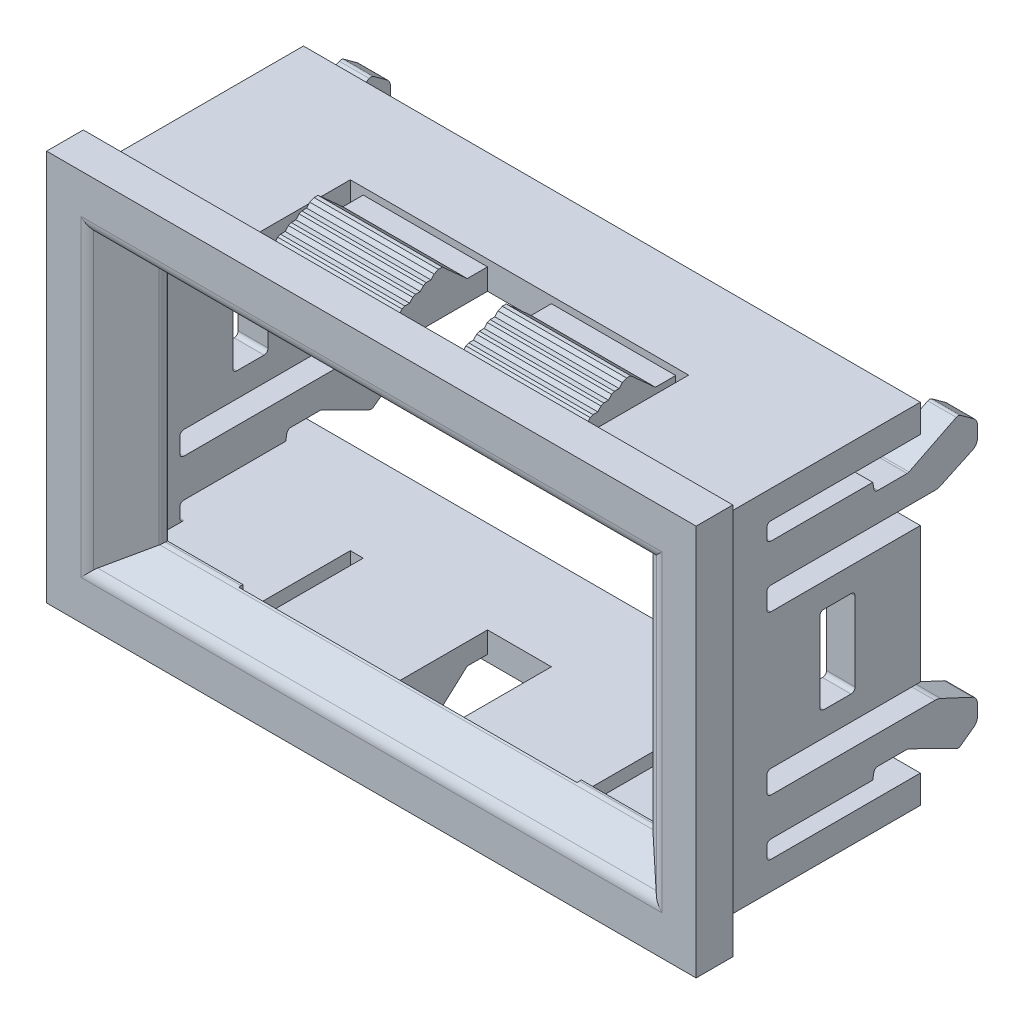
from build123d import *

# Parameters (mm, degrees)
ESQUISSE1_W                         = 47.8
ESQUISSE1_H                         = 28.8
BOSS_EXTRU_1_DEPTH                  = 2.7
ESQUISSE2_W                         = 45.4
ESQUISSE2_H                         = 25.7
BOSS_EXTRU_2_DEPTH                  = 19.2
ESQUISSE3_W                         = 42
ESQUISSE3_H                         = 22
ENL_V_MAT_EXTRU_1_DEPTH             = 3
BOSS_EXTRU_3_REACH                  = 35.87
BOSS_EXTRU_3_DIRECTION_2_REACH      = 35.87
BOSS_EXTRU_4_REACH                  = 35.87
BOSS_EXTRU_4_DIRECTION_2_REACH      = 35.87
CONG_1_R                            = 0.5
CONG_2_R                            = 1
ESQUISSE7_W                         = 41.1
ESQUISSE7_H                         = 21.58
ENL_V_MAT_EXTRU_2_DEPTH             = 18.9
ENL_V_MAT_EXTRU_3_DEPTH             = 34.870488629
ENL_V_MAT_EXTRU_3_DEPTH_BACK        = 34.870488629
ENL_V_MAT_EXTRU_4_DEPTH             = 34.870488629
ENL_V_MAT_EXTRU_4_DEPTH_BACK        = 34.870488629
BOSS_EXTRU_5_DEPTH                  = 9.15
BOSS_EXTRU_6_DEPTH                  = 9.15
ENL_V_MAT_EXTRU_5_REACH             = 35.87
ENL_V_MAT_EXTRU_5_DIRECTION_2_REACH = 35.87


with BuildPart() as part:
    # Esquisse1 → Boss.-Extru.1 (new body)
    with BuildSketch(Plane.XY):
        Rectangle(ESQUISSE1_W, ESQUISSE1_H)
    extrude(amount=BOSS_EXTRU_1_DEPTH)

    # Esquisse2 → Boss.-Extru.2 (add)
    with BuildSketch(Plane(origin=(0, 0, 0), x_dir=(-1, 0, 0), z_dir=(0, 0, -1))):
        Rectangle(ESQUISSE2_W, ESQUISSE2_H)
    extrude(amount=BOSS_EXTRU_2_DEPTH)

    # Esquisse3 → Enlèv. mat.-Extru.1 (cut)
    with BuildSketch(Plane.XY.offset(2.7)):
        Rectangle(ESQUISSE3_W, ESQUISSE3_H)
    extrude(amount=-ENL_V_MAT_EXTRU_1_DEPTH, mode=Mode.SUBTRACT)

    # Esquisse5 → Boss.-Extru.3 (add, up to next)
    with BuildSketch(Plane(origin=(0, 0, 0), x_dir=(0, 0, -1), z_dir=(1, 0, 0)), mode=Mode.PRIVATE) as boss_extru_3_sk1:
        Polygon((-2.7, 11), (0, 9), (0.3, 9), (0.3, 11), align=None)
    boss_extru_3_tool1 = extrude(boss_extru_3_sk1.sketch, amount=BOSS_EXTRU_3_REACH, mode=Mode.PRIVATE) - part.part
    # Esquisse5 → Boss.-Extru.3 (add, up to next)
    with BuildSketch(Plane(origin=(0, 0, 0), x_dir=(0, 0, -1), z_dir=(1, 0, 0)), mode=Mode.PRIVATE) as boss_extru_3_sk2:
        Polygon((0.3, -11), (-2.7, -11), (0, -9), (0.3, -9), align=None)
    boss_extru_3_tool2 = extrude(boss_extru_3_sk2.sketch, amount=BOSS_EXTRU_3_REACH, mode=Mode.PRIVATE) - part.part
    add(boss_extru_3_tool1.solids().sort_by_distance((0, 10.272727, 0.709091))[0])
    add(boss_extru_3_tool2.solids().sort_by_distance((0, -10.272727, 0.709091))[0])

    # Esquisse5 → Boss.-Extru.3 direction 2 (add, up to next)
    with BuildSketch(Plane(origin=(0, 0, 0), x_dir=(0, 0, -1), z_dir=(1, 0, 0)), mode=Mode.PRIVATE) as boss_extru_3_direction_2_sk1:
        Polygon((-2.7, 11), (0, 9), (0.3, 9), (0.3, 11), align=None)
    boss_extru_3_direction_2_tool1 = extrude(boss_extru_3_direction_2_sk1.sketch, amount=-BOSS_EXTRU_3_DIRECTION_2_REACH, mode=Mode.PRIVATE) - part.part
    # Esquisse5 → Boss.-Extru.3 direction 2 (add, up to next)
    with BuildSketch(Plane(origin=(0, 0, 0), x_dir=(0, 0, -1), z_dir=(1, 0, 0)), mode=Mode.PRIVATE) as boss_extru_3_direction_2_sk2:
        Polygon((0.3, -11), (-2.7, -11), (0, -9), (0.3, -9), align=None)
    boss_extru_3_direction_2_tool2 = extrude(boss_extru_3_direction_2_sk2.sketch, amount=-BOSS_EXTRU_3_DIRECTION_2_REACH, mode=Mode.PRIVATE) - part.part
    add(boss_extru_3_direction_2_tool1.solids().sort_by_distance((0, 10.272727, 0.709091))[0])
    add(boss_extru_3_direction_2_tool2.solids().sort_by_distance((0, -10.272727, 0.709091))[0])

    # Esquisse6 → Boss.-Extru.4 (add, up to next)
    with BuildSketch(Plane(origin=(0, 0, 0), x_dir=(1, 0, 0), z_dir=(0, 1, 0)), mode=Mode.PRIVATE) as boss_extru_4_sk1:
        Polygon((-21, -2.7), (-18, 0), (-18, 0.3), (-21, 0.3), align=None)
    boss_extru_4_tool1 = extrude(boss_extru_4_sk1.sketch, amount=BOSS_EXTRU_4_REACH, mode=Mode.PRIVATE) - part.part
    # Esquisse6 → Boss.-Extru.4 (add, up to next)
    with BuildSketch(Plane(origin=(0, 0, 0), x_dir=(1, 0, 0), z_dir=(0, 1, 0)), mode=Mode.PRIVATE) as boss_extru_4_sk2:
        Polygon((18, 0), (18, 0.3), (21, 0.3), (21, -2.7), align=None)
    boss_extru_4_tool2 = extrude(boss_extru_4_sk2.sketch, amount=BOSS_EXTRU_4_REACH, mode=Mode.PRIVATE) - part.part
    add(boss_extru_4_tool1.solids().sort_by_distance((-19.909091, 0, 0.709091))[0])
    add(boss_extru_4_tool2.solids().sort_by_distance((19.909091, 0, 0.709091))[0])

    # Esquisse6 → Boss.-Extru.4 direction 2 (add, up to next)
    with BuildSketch(Plane(origin=(0, 0, 0), x_dir=(1, 0, 0), z_dir=(0, 1, 0)), mode=Mode.PRIVATE) as boss_extru_4_direction_2_sk1:
        Polygon((-21, -2.7), (-18, 0), (-18, 0.3), (-21, 0.3), align=None)
    boss_extru_4_direction_2_tool1 = extrude(boss_extru_4_direction_2_sk1.sketch, amount=-BOSS_EXTRU_4_DIRECTION_2_REACH, mode=Mode.PRIVATE) - part.part
    # Esquisse6 → Boss.-Extru.4 direction 2 (add, up to next)
    with BuildSketch(Plane(origin=(0, 0, 0), x_dir=(1, 0, 0), z_dir=(0, 1, 0)), mode=Mode.PRIVATE) as boss_extru_4_direction_2_sk2:
        Polygon((18, 0), (18, 0.3), (21, 0.3), (21, -2.7), align=None)
    boss_extru_4_direction_2_tool2 = extrude(boss_extru_4_direction_2_sk2.sketch, amount=-BOSS_EXTRU_4_DIRECTION_2_REACH, mode=Mode.PRIVATE) - part.part
    add(boss_extru_4_direction_2_tool1.solids().sort_by_distance((-19.909091, 0, 0.709091))[0])
    add(boss_extru_4_direction_2_tool2.solids().sort_by_distance((19.909091, 0, 0.709091))[0])

    # Congé1
    # the kernel refuses this fillet: 0.5 mm, written as the material it takes off along each edge
    with BuildSketch(Plane(origin=(18, -9, 0), x_dir=(0, -0.5952275506257343, 0.8035571933447481), z_dir=(-1, 0, 0))) as cong_1_piece_1_section:
        with BuildLine():
            CenterArc((CONG_1_R * 0.330029761641, -CONG_1_R), CONG_1_R, 90, 36.528855367)
            Line((-CONG_1_R * 0.265197788985, -CONG_1_R * 0.196442806655), (0, 0))
            Line((0, 0), (CONG_1_R * 0.330029761641, 0))
        make_face()
    cong_1_piece_1 = extrude(amount=36, mode=Mode.PRIVATE)
    cong_1_piece_1 = split(cong_1_piece_1, bisect_by=Plane(origin=(17.922718126, -8.998318551, -0.069553686), z_dir=(0.6689647316224508, 0, -0.7432941462471654)), keep=Keep.TOP, mode=Mode.PRIVATE)
    add(cong_1_piece_1, mode=Mode.SUBTRACT)
    with BuildSketch(Plane(origin=(18.412537202, -9, 0), x_dir=(0, -0.5952275506257328, 0.8035571933447492), z_dir=(-1, 0, 0))) as cong_1_piece_2_section:
        with BuildLine():
            CenterArc((CONG_1_R * 0.330029761641, -CONG_1_R), CONG_1_R, 90, 36.528855367)
            Line((-CONG_1_R * 0.265197788985, -CONG_1_R * 0.196442806655), (0, 0))
            Line((0, 0), (CONG_1_R * 0.330029761641, 0))
        make_face()
    cong_1_piece_2 = extrude(amount=36.412537202, mode=Mode.PRIVATE)
    cong_1_piece_2 = split(cong_1_piece_2, bisect_by=Plane(origin=(18.064588284, -9.056528248, 0.058129455), z_dir=(-0.6689647316224508, 0, 0.7432941462471654)), keep=Keep.TOP, mode=Mode.PRIVATE)
    cong_1_piece_2 = split(cong_1_piece_2, bisect_by=Plane(origin=(18, -9.056528248, 0.080316271), z_dir=(1, 0, 0)), keep=Keep.TOP, mode=Mode.PRIVATE)
    add(cong_1_piece_2, mode=Mode.SUBTRACT)
    with BuildSketch(Plane(origin=(18, -9, 0), x_dir=(0, -0.5952275506257343, 0.8035571933447481), z_dir=(-1, 0, 0))) as cong_1_piece_3_section:
        with BuildLine():
            CenterArc((CONG_1_R * 0.330029761641, -CONG_1_R), CONG_1_R, 90, 36.528855367)
            Line((-CONG_1_R * 0.265197788985, -CONG_1_R * 0.196442806655), (0, 0))
            Line((0, 0), (CONG_1_R * 0.330029761641, 0))
        make_face()
    cong_1_piece_3 = extrude(amount=36, mode=Mode.PRIVATE)
    cong_1_piece_3 = split(cong_1_piece_3, bisect_by=Plane(origin=(-8.052075254, -9.019922949, -8.953132271), z_dir=(0.6689647316224502, 0, 0.7432941462471659)), keep=Keep.TOP, mode=Mode.PRIVATE)
    cong_1_piece_3 = split(cong_1_piece_3, bisect_by=Plane(origin=(8.052075254, -9.019922949, -8.953132271), z_dir=(-0.6689647316224508, 0, 0.7432941462471654)), keep=Keep.TOP, mode=Mode.PRIVATE)
    add(cong_1_piece_3, mode=Mode.SUBTRACT)
    with BuildSketch(Plane(origin=(18, -9, 0), x_dir=(0, -0.5952275506257343, 0.8035571933447481), z_dir=(-1, 0, 0))) as cong_1_piece_4_section:
        with BuildLine():
            CenterArc((CONG_1_R * 0.330029761641, -CONG_1_R), CONG_1_R, 90, 36.528855367)
            Line((-CONG_1_R * 0.265197788985, -CONG_1_R * 0.196442806655), (0, 0))
            Line((0, 0), (CONG_1_R * 0.330029761641, 0))
        make_face()
    cong_1_piece_4 = extrude(amount=36, mode=Mode.PRIVATE)
    cong_1_piece_4 = split(cong_1_piece_4, bisect_by=Plane(origin=(-17.922718126, -8.998318551, -0.069553686), z_dir=(-0.6689647316224502, 0, -0.7432941462471659)), keep=Keep.TOP, mode=Mode.PRIVATE)
    add(cong_1_piece_4, mode=Mode.SUBTRACT)
    with BuildSketch(Plane(origin=(18, -9, 0), x_dir=(0, -0.5952275506257343, 0.8035571933447481), z_dir=(-1, 0, 0))) as cong_1_piece_5_section:
        with BuildLine():
            CenterArc((CONG_1_R * 0.330029761641, -CONG_1_R), CONG_1_R, 90, 36.528855367)
            Line((-CONG_1_R * 0.265197788985, -CONG_1_R * 0.196442806655), (0, 0))
            Line((0, 0), (CONG_1_R * 0.330029761641, 0))
        make_face()
    cong_1_piece_5 = extrude(amount=36.412537202, mode=Mode.PRIVATE)
    cong_1_piece_5 = split(cong_1_piece_5, bisect_by=Plane(origin=(-18.064588284, -9.056528248, 0.058129455), z_dir=(0.6689647316224502, 0, 0.7432941462471659)), keep=Keep.TOP, mode=Mode.PRIVATE)
    cong_1_piece_5 = split(cong_1_piece_5, bisect_by=Plane(origin=(-18, -9.056528248, 0.080316271), z_dir=(-1, 0, 0)), keep=Keep.TOP, mode=Mode.PRIVATE)
    add(cong_1_piece_5, mode=Mode.SUBTRACT)
    with BuildSketch(Plane(origin=(-18.412537202, 9, 0), x_dir=(0, 0, -1), z_dir=(1, 0, 0))) as cong_1_piece_6_section:
        with BuildLine():
            CenterArc((CONG_1_R * 0.330029761641, CONG_1_R), CONG_1_R, 233.471144633, 36.528855367)
            Line((-CONG_1_R * 0.265197788985, CONG_1_R * 0.196442806655), (0, 0))
            Line((0, 0), (CONG_1_R * 0.330029761641, 0))
        make_face()
    cong_1_piece_6 = extrude(amount=36.412537202, mode=Mode.PRIVATE)
    cong_1_piece_6 = split(cong_1_piece_6, bisect_by=Plane(origin=(-18, 9.056528248, 0.080316272), z_dir=(-1, 0, 0)), keep=Keep.TOP, mode=Mode.PRIVATE)
    cong_1_piece_6 = split(cong_1_piece_6, bisect_by=Plane(origin=(-18.064588286, 9.056528248, 0.058129457), z_dir=(0.6689647316224502, 0, 0.7432941462471659)), keep=Keep.TOP, mode=Mode.PRIVATE)
    add(cong_1_piece_6, mode=Mode.SUBTRACT)
    with BuildSketch(Plane(origin=(-18, 9, 0), x_dir=(0, 0, -1), z_dir=(1, 0, 0))) as cong_1_piece_7_section:
        with BuildLine():
            CenterArc((CONG_1_R * 0.330029761641, CONG_1_R), CONG_1_R, 233.471144633, 36.528855367)
            Line((-CONG_1_R * 0.265197788985, CONG_1_R * 0.196442806655), (0, 0))
            Line((0, 0), (CONG_1_R * 0.330029761641, 0))
        make_face()
    cong_1_piece_7 = extrude(amount=36, mode=Mode.PRIVATE)
    cong_1_piece_7 = split(cong_1_piece_7, bisect_by=Plane(origin=(-17.922718127, 8.998318551, -0.069553686), z_dir=(-0.6689647316224502, 0, -0.7432941462471659)), keep=Keep.TOP, mode=Mode.PRIVATE)
    add(cong_1_piece_7, mode=Mode.SUBTRACT)
    with BuildSketch(Plane(origin=(-18, 9, 0), x_dir=(0, 0, -1), z_dir=(1, 0, 0))) as cong_1_piece_8_section:
        with BuildLine():
            CenterArc((CONG_1_R * 0.330029761641, CONG_1_R), CONG_1_R, 233.471144633, 36.528855367)
            Line((-CONG_1_R * 0.265197788985, CONG_1_R * 0.196442806655), (0, 0))
            Line((0, 0), (CONG_1_R * 0.330029761641, 0))
        make_face()
    cong_1_piece_8 = extrude(amount=36, mode=Mode.PRIVATE)
    cong_1_piece_8 = split(cong_1_piece_8, bisect_by=Plane(origin=(-8.052075254, 9.019922949, -8.953132271), z_dir=(0.6689647316224502, 0, 0.7432941462471659)), keep=Keep.TOP, mode=Mode.PRIVATE)
    cong_1_piece_8 = split(cong_1_piece_8, bisect_by=Plane(origin=(8.052075254, 9.019922949, -8.953132271), z_dir=(-0.6689647316224508, 0, 0.7432941462471654)), keep=Keep.TOP, mode=Mode.PRIVATE)
    add(cong_1_piece_8, mode=Mode.SUBTRACT)
    with BuildSketch(Plane(origin=(-18, 9, 0), x_dir=(0, 0, -1), z_dir=(1, 0, 0))) as cong_1_piece_9_section:
        with BuildLine():
            CenterArc((CONG_1_R * 0.330029761641, CONG_1_R), CONG_1_R, 233.471144633, 36.528855367)
            Line((-CONG_1_R * 0.265197788985, CONG_1_R * 0.196442806655), (0, 0))
            Line((0, 0), (CONG_1_R * 0.330029761641, 0))
        make_face()
    cong_1_piece_9 = extrude(amount=36.412537202, mode=Mode.PRIVATE)
    cong_1_piece_9 = split(cong_1_piece_9, bisect_by=Plane(origin=(18, 9.056528248, 0.080316272), z_dir=(1, 0, 0)), keep=Keep.TOP, mode=Mode.PRIVATE)
    cong_1_piece_9 = split(cong_1_piece_9, bisect_by=Plane(origin=(18.064588286, 9.056528248, 0.058129457), z_dir=(-0.6689647316224508, 0, 0.7432941462471654)), keep=Keep.TOP, mode=Mode.PRIVATE)
    add(cong_1_piece_9, mode=Mode.SUBTRACT)
    with BuildSketch(Plane(origin=(-18, 9, 0), x_dir=(0, 0, -1), z_dir=(1, 0, 0))) as cong_1_piece_10_section:
        with BuildLine():
            CenterArc((CONG_1_R * 0.330029761641, CONG_1_R), CONG_1_R, 233.471144633, 36.528855367)
            Line((-CONG_1_R * 0.265197788985, CONG_1_R * 0.196442806655), (0, 0))
            Line((0, 0), (CONG_1_R * 0.330029761641, 0))
        make_face()
    cong_1_piece_10 = extrude(amount=36, mode=Mode.PRIVATE)
    cong_1_piece_10 = split(cong_1_piece_10, bisect_by=Plane(origin=(17.922718127, 8.998318551, -0.069553686), z_dir=(0.6689647316224508, 0, -0.7432941462471654)), keep=Keep.TOP, mode=Mode.PRIVATE)
    add(cong_1_piece_10, mode=Mode.SUBTRACT)
    with BuildSketch(Plane(origin=(-18, -9.556703006, 0), x_dir=(0, 0, -1), z_dir=(0, 1, 0))) as cong_1_piece_11_section:
        with BuildLine():
            CenterArc((CONG_1_R * 0.445362404707, CONG_1_R), CONG_1_R, 221.987212496, 48.012787504)
            Line((-CONG_1_R * 0.29793174154, CONG_1_R * 0.331035268378), (0, 0))
            Line((0, 0), (CONG_1_R * 0.445362404707, 0))
        make_face()
    cong_1_piece_11 = extrude(amount=18.556703006, mode=Mode.PRIVATE)
    cong_1_piece_11 = split(cong_1_piece_11, bisect_by=Plane(origin=(-18.095474591, -9.052623431, 0.071041632), z_dir=(0, 0.8035571933447458, 0.5952275506257375)), keep=Keep.TOP, mode=Mode.PRIVATE)
    cong_1_piece_11 = split(cong_1_piece_11, bisect_by=Plane(origin=(-18.095474591, -9, 0.086335846), z_dir=(0, -1, 0)), keep=Keep.TOP, mode=Mode.PRIVATE)
    add(cong_1_piece_11, mode=Mode.SUBTRACT)
    with BuildSketch(Plane(origin=(-18, -9, 0), x_dir=(0, 0, -1), z_dir=(0, 1, 0))) as cong_1_piece_12_section:
        with BuildLine():
            CenterArc((CONG_1_R * 0.445362404707, CONG_1_R), CONG_1_R, 221.987212496, 48.012787504)
            Line((-CONG_1_R * 0.29793174154, CONG_1_R * 0.331035268378), (0, 0))
            Line((0, 0), (CONG_1_R * 0.445362404707, 0))
        make_face()
    cong_1_piece_12 = extrude(amount=18, mode=Mode.PRIVATE)
    cong_1_piece_12 = split(cong_1_piece_12, bisect_by=Plane(origin=(-18.00198983, -8.926228629, -0.099591351), z_dir=(0, -0.8035571933447458, -0.5952275506257375)), keep=Keep.TOP, mode=Mode.PRIVATE)
    add(cong_1_piece_12, mode=Mode.SUBTRACT)
    with BuildSketch(Plane(origin=(-18, -9, 0), x_dir=(0, 0, -1), z_dir=(0, 1, 0))) as cong_1_piece_13_section:
        with BuildLine():
            CenterArc((CONG_1_R * 0.445362404707, CONG_1_R), CONG_1_R, 221.987212496, 48.012787504)
            Line((-CONG_1_R * 0.29793174154, CONG_1_R * 0.331035268378), (0, 0))
            Line((0, 0), (CONG_1_R * 0.445362404707, 0))
        make_face()
    cong_1_piece_13 = extrude(amount=18, mode=Mode.PRIVATE)
    cong_1_piece_13 = split(cong_1_piece_13, bisect_by=Plane(origin=(-18.035315621, -5.80401026, -4.314586149), z_dir=(0, 0.8035571933447458, 0.5952275506257375)), keep=Keep.TOP, mode=Mode.PRIVATE)
    cong_1_piece_13 = split(cong_1_piece_13, bisect_by=Plane(origin=(-18.035315621, 5.80401026, -4.314586149), z_dir=(0, -0.8035571933447458, 0.5952275506257375)), keep=Keep.TOP, mode=Mode.PRIVATE)
    add(cong_1_piece_13, mode=Mode.SUBTRACT)
    with BuildSketch(Plane(origin=(-18, -9, 0), x_dir=(0, 0, -1), z_dir=(0, 1, 0))) as cong_1_piece_14_section:
        with BuildLine():
            CenterArc((CONG_1_R * 0.445362404707, CONG_1_R), CONG_1_R, 221.987212496, 48.012787504)
            Line((-CONG_1_R * 0.29793174154, CONG_1_R * 0.331035268378), (0, 0))
            Line((0, 0), (CONG_1_R * 0.445362404707, 0))
        make_face()
    cong_1_piece_14 = extrude(amount=18.556703006, mode=Mode.PRIVATE)
    cong_1_piece_14 = split(cong_1_piece_14, bisect_by=Plane(origin=(-18.095474591, 9, 0.086335846), z_dir=(0, 1, 0)), keep=Keep.TOP, mode=Mode.PRIVATE)
    cong_1_piece_14 = split(cong_1_piece_14, bisect_by=Plane(origin=(-18.095474591, 9.052623431, 0.071041632), z_dir=(0, -0.8035571933447458, 0.5952275506257375)), keep=Keep.TOP, mode=Mode.PRIVATE)
    add(cong_1_piece_14, mode=Mode.SUBTRACT)
    with BuildSketch(Plane(origin=(-18, -9, 0), x_dir=(0, 0, -1), z_dir=(0, 1, 0))) as cong_1_piece_15_section:
        with BuildLine():
            CenterArc((CONG_1_R * 0.445362404707, CONG_1_R), CONG_1_R, 221.987212496, 48.012787504)
            Line((-CONG_1_R * 0.29793174154, CONG_1_R * 0.331035268378), (0, 0))
            Line((0, 0), (CONG_1_R * 0.445362404707, 0))
        make_face()
    cong_1_piece_15 = extrude(amount=18, mode=Mode.PRIVATE)
    cong_1_piece_15 = split(cong_1_piece_15, bisect_by=Plane(origin=(-18.00198983, 8.926228629, -0.099591351), z_dir=(0, 0.8035571933447458, -0.5952275506257375)), keep=Keep.TOP, mode=Mode.PRIVATE)
    add(cong_1_piece_15, mode=Mode.SUBTRACT)
    with BuildSketch(Plane(origin=(18, 9.556703006, 0), x_dir=(0, 0, -1), z_dir=(0, -1, 0))) as cong_1_piece_16_section:
        with BuildLine():
            CenterArc((CONG_1_R * 0.445362404707, CONG_1_R), CONG_1_R, 221.987212496, 48.012787504)
            Line((-CONG_1_R * 0.29793174154, CONG_1_R * 0.331035268378), (0, 0))
            Line((0, 0), (CONG_1_R * 0.445362404707, 0))
        make_face()
    cong_1_piece_16 = extrude(amount=18.556703006, mode=Mode.PRIVATE)
    cong_1_piece_16 = split(cong_1_piece_16, bisect_by=Plane(origin=(18.095474591, 9, 0.086335846), z_dir=(0, 1, 0)), keep=Keep.TOP, mode=Mode.PRIVATE)
    cong_1_piece_16 = split(cong_1_piece_16, bisect_by=Plane(origin=(18.095474591, 9.052623431, 0.071041632), z_dir=(0, -0.8035571933447458, 0.5952275506257375)), keep=Keep.TOP, mode=Mode.PRIVATE)
    add(cong_1_piece_16, mode=Mode.SUBTRACT)
    with BuildSketch(Plane(origin=(18, 9, 0), x_dir=(0, 0, -1), z_dir=(0, -1, 0))) as cong_1_piece_17_section:
        with BuildLine():
            CenterArc((CONG_1_R * 0.445362404707, CONG_1_R), CONG_1_R, 221.987212496, 48.012787504)
            Line((-CONG_1_R * 0.29793174154, CONG_1_R * 0.331035268378), (0, 0))
            Line((0, 0), (CONG_1_R * 0.445362404707, 0))
        make_face()
    cong_1_piece_17 = extrude(amount=18, mode=Mode.PRIVATE)
    cong_1_piece_17 = split(cong_1_piece_17, bisect_by=Plane(origin=(18.00198983, 8.926228629, -0.099591351), z_dir=(0, 0.8035571933447458, -0.5952275506257375)), keep=Keep.TOP, mode=Mode.PRIVATE)
    add(cong_1_piece_17, mode=Mode.SUBTRACT)
    with BuildSketch(Plane(origin=(18, 9, 0), x_dir=(0, 0, -1), z_dir=(0, -1, 0))) as cong_1_piece_18_section:
        with BuildLine():
            CenterArc((CONG_1_R * 0.445362404707, CONG_1_R), CONG_1_R, 221.987212496, 48.012787504)
            Line((-CONG_1_R * 0.29793174154, CONG_1_R * 0.331035268378), (0, 0))
            Line((0, 0), (CONG_1_R * 0.445362404707, 0))
        make_face()
    cong_1_piece_18 = extrude(amount=18, mode=Mode.PRIVATE)
    cong_1_piece_18 = split(cong_1_piece_18, bisect_by=Plane(origin=(18.035315621, -5.80401026, -4.314586149), z_dir=(0, 0.8035571933447458, 0.5952275506257375)), keep=Keep.TOP, mode=Mode.PRIVATE)
    cong_1_piece_18 = split(cong_1_piece_18, bisect_by=Plane(origin=(18.035315621, 5.80401026, -4.314586149), z_dir=(0, -0.8035571933447458, 0.5952275506257375)), keep=Keep.TOP, mode=Mode.PRIVATE)
    add(cong_1_piece_18, mode=Mode.SUBTRACT)
    with BuildSketch(Plane(origin=(18, 9, 0), x_dir=(0, 0, -1), z_dir=(0, -1, 0))) as cong_1_piece_19_section:
        with BuildLine():
            CenterArc((CONG_1_R * 0.445362404707, CONG_1_R), CONG_1_R, 221.987212496, 48.012787504)
            Line((-CONG_1_R * 0.29793174154, CONG_1_R * 0.331035268378), (0, 0))
            Line((0, 0), (CONG_1_R * 0.445362404707, 0))
        make_face()
    cong_1_piece_19 = extrude(amount=18.556703006, mode=Mode.PRIVATE)
    cong_1_piece_19 = split(cong_1_piece_19, bisect_by=Plane(origin=(18.095474591, -9.052623431, 0.071041632), z_dir=(0, 0.8035571933447458, 0.5952275506257375)), keep=Keep.TOP, mode=Mode.PRIVATE)
    cong_1_piece_19 = split(cong_1_piece_19, bisect_by=Plane(origin=(18.095474591, -9, 0.086335846), z_dir=(0, -1, 0)), keep=Keep.TOP, mode=Mode.PRIVATE)
    add(cong_1_piece_19, mode=Mode.SUBTRACT)
    with BuildSketch(Plane(origin=(18, 9, 0), x_dir=(0, 0, -1), z_dir=(0, -1, 0))) as cong_1_piece_20_section:
        with BuildLine():
            CenterArc((CONG_1_R * 0.445362404707, CONG_1_R), CONG_1_R, 221.987212496, 48.012787504)
            Line((-CONG_1_R * 0.29793174154, CONG_1_R * 0.331035268378), (0, 0))
            Line((0, 0), (CONG_1_R * 0.445362404707, 0))
        make_face()
    cong_1_piece_20 = extrude(amount=18, mode=Mode.PRIVATE)
    cong_1_piece_20 = split(cong_1_piece_20, bisect_by=Plane(origin=(18.00198983, -8.926228629, -0.099591351), z_dir=(0, -0.8035571933447458, -0.5952275506257375)), keep=Keep.TOP, mode=Mode.PRIVATE)
    add(cong_1_piece_20, mode=Mode.SUBTRACT)
    with BuildSketch(Plane(origin=(18.412537202, -9, 0), x_dir=(0, -0.5952275506257328, 0.8035571933447492), z_dir=(-1, 0, 0))) as cong_1_piece_21a_section:
        with BuildLine():
            CenterArc((CONG_1_R * 0.330029761641, -CONG_1_R), CONG_1_R, 90, 36.528855367)
            Line((-CONG_1_R * 0.265197788985, -CONG_1_R * 0.196442806655), (0, 0))
            Line((0, 0), (CONG_1_R * 0.330029761641, 0))
        make_face()
    cong_1_piece_21a = extrude(amount=36.412537202, mode=Mode.PRIVATE)
    cong_1_piece_21a = split(cong_1_piece_21a, bisect_by=Plane(origin=(18.114134712, -9.017148505, 0.10272124), z_dir=(0.6689647316224508, 0, -0.7432941462471654)), keep=Keep.TOP, mode=Mode.PRIVATE)
    cong_1_piece_21a = split(cong_1_piece_21a, bisect_by=Plane(origin=(18, -9.017148505, -0.013035779), z_dir=(1, 0, 0)), keep=Keep.TOP, mode=Mode.PRIVATE)
    with BuildSketch(Plane(origin=(18, 9, 0), x_dir=(0, 0, -1), z_dir=(0, -1, 0))) as cong_1_piece_21b_section:
        with BuildLine():
            CenterArc((CONG_1_R * 0.445362404707, CONG_1_R), CONG_1_R, 221.987212496, 48.012787504)
            Line((-CONG_1_R * 0.29793174154, CONG_1_R * 0.331035268378), (0, 0))
            Line((0, 0), (CONG_1_R * 0.445362404707, 0))
        make_face()
    cong_1_piece_21b = extrude(amount=18.556703006, mode=Mode.PRIVATE)
    cong_1_piece_21b = split(cong_1_piece_21b, bisect_by=Plane(origin=(18.033082392, -9.092474243, 0.124840228), z_dir=(0, -0.8035571933447458, -0.5952275506257375)), keep=Keep.TOP, mode=Mode.PRIVATE)
    cong_1_piece_21b = split(cong_1_piece_21b, bisect_by=Plane(origin=(18.033082392, -9, -0.019266418), z_dir=(0, -1, 0)), keep=Keep.TOP, mode=Mode.PRIVATE)
    cong_1_piece_21 = cong_1_piece_21a & cong_1_piece_21b
    add(cong_1_piece_21, mode=Mode.SUBTRACT)
    with BuildSketch(Plane(origin=(18, -9, 0), x_dir=(0, -0.5952275506257343, 0.8035571933447481), z_dir=(-1, 0, 0))) as cong_1_piece_22a_section:
        with BuildLine():
            CenterArc((CONG_1_R * 0.330029761641, -CONG_1_R), CONG_1_R, 90, 36.528855367)
            Line((-CONG_1_R * 0.265197788985, -CONG_1_R * 0.196442806655), (0, 0))
            Line((0, 0), (CONG_1_R * 0.330029761641, 0))
        make_face()
    cong_1_piece_22a = extrude(amount=36.412537202, mode=Mode.PRIVATE)
    cong_1_piece_22a = split(cong_1_piece_22a, bisect_by=Plane(origin=(-18.114134712, -9.017148505, 0.10272124), z_dir=(-0.6689647316224502, 0, -0.7432941462471659)), keep=Keep.TOP, mode=Mode.PRIVATE)
    cong_1_piece_22a = split(cong_1_piece_22a, bisect_by=Plane(origin=(-18, -9.017148505, -0.013035779), z_dir=(-1, 0, 0)), keep=Keep.TOP, mode=Mode.PRIVATE)
    with BuildSketch(Plane(origin=(-18, -9.556703006, 0), x_dir=(0, 0, -1), z_dir=(0, 1, 0))) as cong_1_piece_22b_section:
        with BuildLine():
            CenterArc((CONG_1_R * 0.445362404707, CONG_1_R), CONG_1_R, 221.987212496, 48.012787504)
            Line((-CONG_1_R * 0.29793174154, CONG_1_R * 0.331035268378), (0, 0))
            Line((0, 0), (CONG_1_R * 0.445362404707, 0))
        make_face()
    cong_1_piece_22b = extrude(amount=18.556703006, mode=Mode.PRIVATE)
    cong_1_piece_22b = split(cong_1_piece_22b, bisect_by=Plane(origin=(-18.033082392, -9.092474243, 0.124840228), z_dir=(0, -0.8035571933447458, -0.5952275506257375)), keep=Keep.TOP, mode=Mode.PRIVATE)
    cong_1_piece_22b = split(cong_1_piece_22b, bisect_by=Plane(origin=(-18.033082392, -9, -0.019266418), z_dir=(0, -1, 0)), keep=Keep.TOP, mode=Mode.PRIVATE)
    cong_1_piece_22 = cong_1_piece_22a & cong_1_piece_22b
    add(cong_1_piece_22, mode=Mode.SUBTRACT)
    with BuildSketch(Plane(origin=(-18.412537202, 9, 0), x_dir=(0, 0, -1), z_dir=(1, 0, 0))) as cong_1_piece_23a_section:
        with BuildLine():
            CenterArc((CONG_1_R * 0.330029761641, CONG_1_R), CONG_1_R, 233.471144633, 36.528855367)
            Line((-CONG_1_R * 0.265197788985, CONG_1_R * 0.196442806655), (0, 0))
            Line((0, 0), (CONG_1_R * 0.330029761641, 0))
        make_face()
    cong_1_piece_23a = extrude(amount=36.412537202, mode=Mode.PRIVATE)
    cong_1_piece_23a = split(cong_1_piece_23a, bisect_by=Plane(origin=(-18, 9.017148504, -0.013035779), z_dir=(-1, 0, 0)), keep=Keep.TOP, mode=Mode.PRIVATE)
    cong_1_piece_23a = split(cong_1_piece_23a, bisect_by=Plane(origin=(-18.114134713, 9.017148504, 0.102721242), z_dir=(-0.6689647316224502, 0, -0.7432941462471659)), keep=Keep.TOP, mode=Mode.PRIVATE)
    with BuildSketch(Plane(origin=(-18, -9, 0), x_dir=(0, 0, -1), z_dir=(0, 1, 0))) as cong_1_piece_23b_section:
        with BuildLine():
            CenterArc((CONG_1_R * 0.445362404707, CONG_1_R), CONG_1_R, 221.987212496, 48.012787504)
            Line((-CONG_1_R * 0.29793174154, CONG_1_R * 0.331035268378), (0, 0))
            Line((0, 0), (CONG_1_R * 0.445362404707, 0))
        make_face()
    cong_1_piece_23b = extrude(amount=18.556703006, mode=Mode.PRIVATE)
    cong_1_piece_23b = split(cong_1_piece_23b, bisect_by=Plane(origin=(-18.033082392, 9, -0.019266418), z_dir=(0, 1, 0)), keep=Keep.TOP, mode=Mode.PRIVATE)
    cong_1_piece_23b = split(cong_1_piece_23b, bisect_by=Plane(origin=(-18.033082392, 9.092474243, 0.124840228), z_dir=(0, 0.8035571933447458, -0.5952275506257375)), keep=Keep.TOP, mode=Mode.PRIVATE)
    cong_1_piece_23 = cong_1_piece_23a & cong_1_piece_23b
    add(cong_1_piece_23, mode=Mode.SUBTRACT)
    with BuildSketch(Plane(origin=(18, 9.556703006, 0), x_dir=(0, 0, -1), z_dir=(0, -1, 0))) as cong_1_piece_24a_section:
        with BuildLine():
            CenterArc((CONG_1_R * 0.445362404707, CONG_1_R), CONG_1_R, 221.987212496, 48.012787504)
            Line((-CONG_1_R * 0.29793174154, CONG_1_R * 0.331035268378), (0, 0))
            Line((0, 0), (CONG_1_R * 0.445362404707, 0))
        make_face()
    cong_1_piece_24a = extrude(amount=18.556703006, mode=Mode.PRIVATE)
    cong_1_piece_24a = split(cong_1_piece_24a, bisect_by=Plane(origin=(18.033082392, 9, -0.019266418), z_dir=(0, 1, 0)), keep=Keep.TOP, mode=Mode.PRIVATE)
    cong_1_piece_24a = split(cong_1_piece_24a, bisect_by=Plane(origin=(18.033082392, 9.092474243, 0.124840228), z_dir=(0, 0.8035571933447458, -0.5952275506257375)), keep=Keep.TOP, mode=Mode.PRIVATE)
    with BuildSketch(Plane(origin=(-18, 9, 0), x_dir=(0, 0, -1), z_dir=(1, 0, 0))) as cong_1_piece_24b_section:
        with BuildLine():
            CenterArc((CONG_1_R * 0.330029761641, CONG_1_R), CONG_1_R, 233.471144633, 36.528855367)
            Line((-CONG_1_R * 0.265197788985, CONG_1_R * 0.196442806655), (0, 0))
            Line((0, 0), (CONG_1_R * 0.330029761641, 0))
        make_face()
    cong_1_piece_24b = extrude(amount=36.412537202, mode=Mode.PRIVATE)
    cong_1_piece_24b = split(cong_1_piece_24b, bisect_by=Plane(origin=(18, 9.017148504, -0.013035779), z_dir=(1, 0, 0)), keep=Keep.TOP, mode=Mode.PRIVATE)
    cong_1_piece_24b = split(cong_1_piece_24b, bisect_by=Plane(origin=(18.114134713, 9.017148504, 0.102721242), z_dir=(0.6689647316224508, 0, -0.7432941462471654)), keep=Keep.TOP, mode=Mode.PRIVATE)
    cong_1_piece_24 = cong_1_piece_24a & cong_1_piece_24b
    add(cong_1_piece_24, mode=Mode.SUBTRACT)

    # Congé2
    cong_2_edges = [part.edges().sort_by_distance(p)[0] for p in [
        (21, 0, 2.7),
        (0, 11, 2.7),
        (-21, 0, 2.7),
        (0, -11, 2.7),
    ]]
    fillet(cong_2_edges, radius=CONG_2_R)

    # Esquisse7 → Enlèv. mat.-Extru.2 (cut)
    with BuildSketch(Plane(origin=(0, 0, -19.2), x_dir=(-1, 0, 0), z_dir=(0, 0, -1))):
        with Locations((-0.05, 0)):
            Rectangle(ESQUISSE7_W, ESQUISSE7_H)
    extrude(amount=-ENL_V_MAT_EXTRU_2_DEPTH, mode=Mode.SUBTRACT)

    # Esquisse9 → Enlèv. mat.-Extru.3 (cut, two sides: drawn at the far end of the back side and taken through both)
    with BuildSketch(Plane(origin=(0, 0, 0), x_dir=(0, 0, -1), z_dir=(1, 0, 0)).offset(-ENL_V_MAT_EXTRU_3_DEPTH_BACK)):
        with BuildLine():
            Line((7.9, 3.2), (9.9, 3.2))
            ThreePointArc((9.9, 3.2), (10.112132034, 3.112132034), (10.2, 2.9))
            Line((10.2, 2.9), (10.2, -2.9))
            ThreePointArc((10.2, -2.9), (10.112132034, -3.112132034), (9.9, -3.2))
            Line((9.9, -3.2), (7.9, -3.2))
            ThreePointArc((7.9, -3.2), (7.687867966, -3.112132034), (7.6, -2.9))
            Line((7.6, -2.9), (7.6, 2.9))
            ThreePointArc((7.6, 2.9), (7.687867966, 3.112132034), (7.9, 3.2))
        make_face()
        with BuildLine():
            Line((4, 10.79), (15, 10.79))
            Line((15, 10.79), (15, 12.85))
            Line((15, 12.85), (22.243100216, 12.85))
            Line((22.243100216, 12.85), (22.243100216, -12.85))
            Line((22.243100216, -12.85), (15, -12.85))
            Line((15, -12.85), (15, -10.79))
            Line((15, -10.79), (4, -10.79))
            ThreePointArc((4, -10.79), (3.787867966, -10.702132034), (3.7, -10.49))
            Line((3.7, -10.49), (3.7, -9.79))
            ThreePointArc((3.7, -9.79), (3.787867966, -9.577867966), (4, -9.49))
            Line((4, -9.49), (11.5, -9.49))
            Line((11.5, -9.49), (11.57971645, -9.037905547))
            ThreePointArc((11.57971645, -9.037905547), (11.682322493, -8.860186667), (11.875158776, -8.79))
            Line((11.875158776, -8.79), (14.029359377, -8.79))
            ThreePointArc((14.029359377, -8.79), (14.098119494, -8.797986222), (14.163218721, -8.821519692))
            Line((14.163218721, -8.821519692), (17.647022754, -10.558480308))
            ThreePointArc((17.647022754, -10.558480308), (17.80572456, -10.588969651), (17.957217674, -10.532705098))
            Line((17.957217674, -10.532705098), (18.952671151, -9.809465812))
            ThreePointArc((18.952671151, -9.809465812), (19.134603915, -9.596449915), (19.2, -9.324055615))
            Line((19.2, -9.324055615), (19.2, -8.424534365))
            ThreePointArc((19.2, -8.424534365), (19.106034867, -8.1021546), (18.853570957, -7.880749693))
            Line((18.853570957, -7.880749693), (16.500923599, -6.783692213))
            ThreePointArc((16.500923599, -6.783692213), (16.294744951, -6.713703993), (16.078305337, -6.69))
            Line((16.078305337, -6.69), (4, -6.69))
            ThreePointArc((4, -6.69), (3.787867966, -6.602132034), (3.7, -6.39))
            Line((3.7, -6.39), (3.7, -5.29))
            ThreePointArc((3.7, -5.29), (3.787867966, -5.077867966), (4, -4.99))
            Line((4, -4.99), (15, -4.99))
            Line((15, -4.99), (15, 4.99))
            Line((15, 4.99), (4, 4.99))
            ThreePointArc((4, 4.99), (3.787867966, 5.077867966), (3.7, 5.29))
            Line((3.7, 5.29), (3.7, 6.39))
            ThreePointArc((3.7, 6.39), (3.787867966, 6.602132034), (4, 6.69))
            Line((4, 6.69), (16.078305337, 6.69))
            ThreePointArc((16.078305337, 6.69), (16.294744951, 6.713703993), (16.500923599, 6.783692213))
            Line((16.500923599, 6.783692213), (18.853570957, 7.880749693))
            ThreePointArc((18.853570957, 7.880749693), (19.106034867, 8.1021546), (19.2, 8.424534365))
            Line((19.2, 8.424534365), (19.2, 9.324055615))
            ThreePointArc((19.2, 9.324055615), (19.134603915, 9.596449915), (18.952671151, 9.809465812))
            Line((18.952671151, 9.809465812), (17.957217674, 10.532705098))
            ThreePointArc((17.957217674, 10.532705098), (17.80572456, 10.588969651), (17.647022754, 10.558480308))
            Line((17.647022754, 10.558480308), (14.163218721, 8.821519692))
            ThreePointArc((14.163218721, 8.821519692), (14.098119494, 8.797986222), (14.029359377, 8.79))
            Line((14.029359377, 8.79), (11.875158776, 8.79))
            ThreePointArc((11.875158776, 8.79), (11.682322493, 8.860186667), (11.57971645, 9.037905547))
            Line((11.57971645, 9.037905547), (11.5, 9.49))
            Line((11.5, 9.49), (4, 9.49))
            ThreePointArc((4, 9.49), (3.787867966, 9.577867966), (3.7, 9.79))
            Line((3.7, 9.79), (3.7, 10.49))
            ThreePointArc((3.7, 10.49), (3.787867966, 10.702132034), (4, 10.79))
        make_face()
    extrude(amount=ENL_V_MAT_EXTRU_3_DEPTH + ENL_V_MAT_EXTRU_3_DEPTH_BACK, mode=Mode.SUBTRACT)

    # Esquisse12 → Enlèv. mat.-Extru.4 (cut, two sides: drawn at the far end of the back side and taken through both)
    with BuildSketch(Plane(origin=(0, 0, 0), x_dir=(1, 0, 0), z_dir=(0, 1, 0)).offset(-ENL_V_MAT_EXTRU_4_DEPTH_BACK)):
        Polygon((-12.45, 8.2), (-11.5, 8.2), (-11.5, 1.6), (-2.35, 1.6), (-2.35, 8.2), (2.35, 8.2), (2.35, 1.6), (11.5, 1.6), (11.5, 8.2), (12.45, 8.2), (12.45, 0), (-12.45, 0), align=None)
    extrude(amount=ENL_V_MAT_EXTRU_4_DEPTH + ENL_V_MAT_EXTRU_4_DEPTH_BACK, mode=Mode.SUBTRACT)

    # Esquisse13 → Boss.-Extru.5 (add)
    with BuildSketch(Plane(origin=(-2.35, 0, 0), x_dir=(0, 0, -1), z_dir=(1, 0, 0))):
        Polygon((4.776892016, 14.086351982), (6.15, 12.85), (2, 12.85), align=None)
        Polygon((2, -12.85), (6.15, -12.85), (4.776892016, -14.086351982), align=None)
    extrude(amount=-BOSS_EXTRU_5_DEPTH)

    # Esquisse14 → Boss.-Extru.6 (add)
    with BuildSketch(Plane.ZY.offset(-2.35)):
        Polygon((-2, -12.85), (-6.15, -12.85), (-4.776892016, -14.086351982), align=None)
        Polygon((-4.776892016, 14.086351982), (-6.15, 12.85), (-2, 12.85), align=None)
    extrude(amount=-BOSS_EXTRU_6_DEPTH)

    # Enlèv. mat.-Extru.5: up to this face of the body (flat: up to its plane)
    enl_v_mat_extru_5_end = Plane(part.part.faces().sort_by_distance((-11.5, 12.048918573, -4.80618023))[0])
    # Esquisse16 → Enlèv. mat.-Extru.5 (cut, up to the picked face)
    with BuildSketch(Plane(origin=(0, 0, 0), x_dir=(0, 0, -1), z_dir=(1, 0, 0)), mode=Mode.PRIVATE) as enl_v_mat_extru_5_sk1:
        Polygon((4.872795608, 14), (6.705306257, 12.35), (8.2, 12.35), (8.2, 14.086351982), (4.776892016, 14.086351982), (4.58294229, 14), align=None)
    enl_v_mat_extru_5_tool1 = split(extrude(enl_v_mat_extru_5_sk1.sketch, amount=-ENL_V_MAT_EXTRU_5_REACH, mode=Mode.PRIVATE), bisect_by=enl_v_mat_extru_5_end, keep=Keep.BOTH, mode=Mode.PRIVATE)
    # Esquisse16 → Enlèv. mat.-Extru.5 (cut, up to the picked face)
    with BuildSketch(Plane(origin=(0, 0, 0), x_dir=(0, 0, -1), z_dir=(1, 0, 0)), mode=Mode.PRIVATE) as enl_v_mat_extru_5_sk2:
        Polygon((1.91038468, 12.810100689), (1.6, 12.465383579), (1.6, 12.85), (2, 12.85), align=None)
    enl_v_mat_extru_5_tool2 = split(extrude(enl_v_mat_extru_5_sk2.sketch, amount=-ENL_V_MAT_EXTRU_5_REACH, mode=Mode.PRIVATE), bisect_by=enl_v_mat_extru_5_end, keep=Keep.BOTH, mode=Mode.PRIVATE)
    # Esquisse16 → Enlèv. mat.-Extru.5 (cut, up to the picked face)
    with BuildSketch(Plane(origin=(0, 0, 0), x_dir=(0, 0, -1), z_dir=(1, 0, 0)), mode=Mode.PRIVATE) as enl_v_mat_extru_5_sk3:
        Polygon((4.03452758, 13.6), (3.68452758, 13.6), (4.268723293, 13.860100689), align=None)
    enl_v_mat_extru_5_tool3 = split(extrude(enl_v_mat_extru_5_sk3.sketch, amount=-ENL_V_MAT_EXTRU_5_REACH, mode=Mode.PRIVATE), bisect_by=enl_v_mat_extru_5_end, keep=Keep.BOTH, mode=Mode.PRIVATE)
    # Esquisse16 → Enlèv. mat.-Extru.5 (cut, up to the picked face)
    with BuildSketch(Plane(origin=(0, 0, 0), x_dir=(0, 0, -1), z_dir=(1, 0, 0)), mode=Mode.PRIVATE) as enl_v_mat_extru_5_sk4:
        Polygon((3.482610422, 13.510100689), (2.89841471, 13.25), (3.24841471, 13.25), align=None)
    enl_v_mat_extru_5_tool4 = split(extrude(enl_v_mat_extru_5_sk4.sketch, amount=-ENL_V_MAT_EXTRU_5_REACH, mode=Mode.PRIVATE), bisect_by=enl_v_mat_extru_5_end, keep=Keep.BOTH, mode=Mode.PRIVATE)
    # Esquisse16 → Enlèv. mat.-Extru.5 (cut, up to the picked face)
    with BuildSketch(Plane(origin=(0, 0, 0), x_dir=(0, 0, -1), z_dir=(1, 0, 0)), mode=Mode.PRIVATE) as enl_v_mat_extru_5_sk5:
        Polygon((2.696497551, 13.160100689), (2.112301839, 12.9), (2.462301839, 12.9), align=None)
    enl_v_mat_extru_5_tool5 = split(extrude(enl_v_mat_extru_5_sk5.sketch, amount=-ENL_V_MAT_EXTRU_5_REACH, mode=Mode.PRIVATE), bisect_by=enl_v_mat_extru_5_end, keep=Keep.BOTH, mode=Mode.PRIVATE)
    enl_v_mat_extru_5_1 = enl_v_mat_extru_5_tool1.solids().sort_by(Axis((0, 13.333693, -6.901211), (-1, 0, 0)))[0]
    add(enl_v_mat_extru_5_1, mode=Mode.SUBTRACT)
    enl_v_mat_extru_5_2 = enl_v_mat_extru_5_tool2.solids().sort_by(Axis((0, 12.723613, -1.719185), (-1, 0, 0)))[0]
    add(enl_v_mat_extru_5_2, mode=Mode.SUBTRACT)
    enl_v_mat_extru_5_3 = enl_v_mat_extru_5_tool3.solids().sort_by(Axis((0, 13.6867, -3.995926), (-1, 0, 0)))[0]
    add(enl_v_mat_extru_5_3, mode=Mode.SUBTRACT)
    enl_v_mat_extru_5_4 = enl_v_mat_extru_5_tool4.solids().sort_by(Axis((0, 13.3367, -3.209813), (-1, 0, 0)))[0]
    add(enl_v_mat_extru_5_4, mode=Mode.SUBTRACT)
    enl_v_mat_extru_5_5 = enl_v_mat_extru_5_tool5.solids().sort_by(Axis((0, 12.9867, -2.4237), (-1, 0, 0)))[0]
    add(enl_v_mat_extru_5_5, mode=Mode.SUBTRACT)
    enl_v_mat_extru_5 = enl_v_mat_extru_5_1 + enl_v_mat_extru_5_2 + enl_v_mat_extru_5_3 + enl_v_mat_extru_5_4 + enl_v_mat_extru_5_5  # Enlèv. mat.-Extru.5 as one shape, for the pattern or mirror that repeats it

    # Enlèv. mat.-Extru.5 direction 2: up to this face of the body (flat: up to its plane)
    enl_v_mat_extru_5_direction_2_end = Plane(part.part.faces().sort_by_distance((11.5, 12.048918573, -4.80618023))[0])
    # Esquisse16 → Enlèv. mat.-Extru.5 direction 2 (cut, up to the picked face)
    with BuildSketch(Plane(origin=(0, 0, 0), x_dir=(0, 0, -1), z_dir=(1, 0, 0)), mode=Mode.PRIVATE) as enl_v_mat_extru_5_direction_2_sk1:
        Polygon((4.872795608, 14), (6.705306257, 12.35), (8.2, 12.35), (8.2, 14.086351982), (4.776892016, 14.086351982), (4.58294229, 14), align=None)
    enl_v_mat_extru_5_direction_2_tool1 = split(extrude(enl_v_mat_extru_5_direction_2_sk1.sketch, amount=ENL_V_MAT_EXTRU_5_DIRECTION_2_REACH, mode=Mode.PRIVATE), bisect_by=enl_v_mat_extru_5_direction_2_end, keep=Keep.BOTH, mode=Mode.PRIVATE)
    # Esquisse16 → Enlèv. mat.-Extru.5 direction 2 (cut, up to the picked face)
    with BuildSketch(Plane(origin=(0, 0, 0), x_dir=(0, 0, -1), z_dir=(1, 0, 0)), mode=Mode.PRIVATE) as enl_v_mat_extru_5_direction_2_sk2:
        Polygon((1.91038468, 12.810100689), (1.6, 12.465383579), (1.6, 12.85), (2, 12.85), align=None)
    enl_v_mat_extru_5_direction_2_tool2 = split(extrude(enl_v_mat_extru_5_direction_2_sk2.sketch, amount=ENL_V_MAT_EXTRU_5_DIRECTION_2_REACH, mode=Mode.PRIVATE), bisect_by=enl_v_mat_extru_5_direction_2_end, keep=Keep.BOTH, mode=Mode.PRIVATE)
    # Esquisse16 → Enlèv. mat.-Extru.5 direction 2 (cut, up to the picked face)
    with BuildSketch(Plane(origin=(0, 0, 0), x_dir=(0, 0, -1), z_dir=(1, 0, 0)), mode=Mode.PRIVATE) as enl_v_mat_extru_5_direction_2_sk3:
        Polygon((4.03452758, 13.6), (3.68452758, 13.6), (4.268723293, 13.860100689), align=None)
    enl_v_mat_extru_5_direction_2_tool3 = split(extrude(enl_v_mat_extru_5_direction_2_sk3.sketch, amount=ENL_V_MAT_EXTRU_5_DIRECTION_2_REACH, mode=Mode.PRIVATE), bisect_by=enl_v_mat_extru_5_direction_2_end, keep=Keep.BOTH, mode=Mode.PRIVATE)
    # Esquisse16 → Enlèv. mat.-Extru.5 direction 2 (cut, up to the picked face)
    with BuildSketch(Plane(origin=(0, 0, 0), x_dir=(0, 0, -1), z_dir=(1, 0, 0)), mode=Mode.PRIVATE) as enl_v_mat_extru_5_direction_2_sk4:
        Polygon((3.482610422, 13.510100689), (2.89841471, 13.25), (3.24841471, 13.25), align=None)
    enl_v_mat_extru_5_direction_2_tool4 = split(extrude(enl_v_mat_extru_5_direction_2_sk4.sketch, amount=ENL_V_MAT_EXTRU_5_DIRECTION_2_REACH, mode=Mode.PRIVATE), bisect_by=enl_v_mat_extru_5_direction_2_end, keep=Keep.BOTH, mode=Mode.PRIVATE)
    # Esquisse16 → Enlèv. mat.-Extru.5 direction 2 (cut, up to the picked face)
    with BuildSketch(Plane(origin=(0, 0, 0), x_dir=(0, 0, -1), z_dir=(1, 0, 0)), mode=Mode.PRIVATE) as enl_v_mat_extru_5_direction_2_sk5:
        Polygon((2.696497551, 13.160100689), (2.112301839, 12.9), (2.462301839, 12.9), align=None)
    enl_v_mat_extru_5_direction_2_tool5 = split(extrude(enl_v_mat_extru_5_direction_2_sk5.sketch, amount=ENL_V_MAT_EXTRU_5_DIRECTION_2_REACH, mode=Mode.PRIVATE), bisect_by=enl_v_mat_extru_5_direction_2_end, keep=Keep.BOTH, mode=Mode.PRIVATE)
    enl_v_mat_extru_5_direction_2_1 = enl_v_mat_extru_5_direction_2_tool1.solids().sort_by(Axis((0, 13.333693, -6.901211), (1, 0, 0)))[0]
    add(enl_v_mat_extru_5_direction_2_1, mode=Mode.SUBTRACT)
    enl_v_mat_extru_5_direction_2_2 = enl_v_mat_extru_5_direction_2_tool2.solids().sort_by(Axis((0, 12.723613, -1.719185), (1, 0, 0)))[0]
    add(enl_v_mat_extru_5_direction_2_2, mode=Mode.SUBTRACT)
    enl_v_mat_extru_5_direction_2_3 = enl_v_mat_extru_5_direction_2_tool3.solids().sort_by(Axis((0, 13.6867, -3.995926), (1, 0, 0)))[0]
    add(enl_v_mat_extru_5_direction_2_3, mode=Mode.SUBTRACT)
    enl_v_mat_extru_5_direction_2_4 = enl_v_mat_extru_5_direction_2_tool4.solids().sort_by(Axis((0, 13.3367, -3.209813), (1, 0, 0)))[0]
    add(enl_v_mat_extru_5_direction_2_4, mode=Mode.SUBTRACT)
    enl_v_mat_extru_5_direction_2_5 = enl_v_mat_extru_5_direction_2_tool5.solids().sort_by(Axis((0, 12.9867, -2.4237), (1, 0, 0)))[0]
    add(enl_v_mat_extru_5_direction_2_5, mode=Mode.SUBTRACT)
    enl_v_mat_extru_5_direction_2 = enl_v_mat_extru_5_direction_2_1 + enl_v_mat_extru_5_direction_2_2 + enl_v_mat_extru_5_direction_2_3 + enl_v_mat_extru_5_direction_2_4 + enl_v_mat_extru_5_direction_2_5  # Enlèv. mat.-Extru.5 direction 2 as one shape, for the pattern or mirror that repeats it

    # Symétrie1: Enlèv. mat.-Extru.5, Enlèv. mat.-Extru.5 direction 2 across plane
    add(enl_v_mat_extru_5.mirror(Plane.ZX), mode=Mode.SUBTRACT)
    add(enl_v_mat_extru_5_direction_2.mirror(Plane.ZX), mode=Mode.SUBTRACT)


solid = part.part
